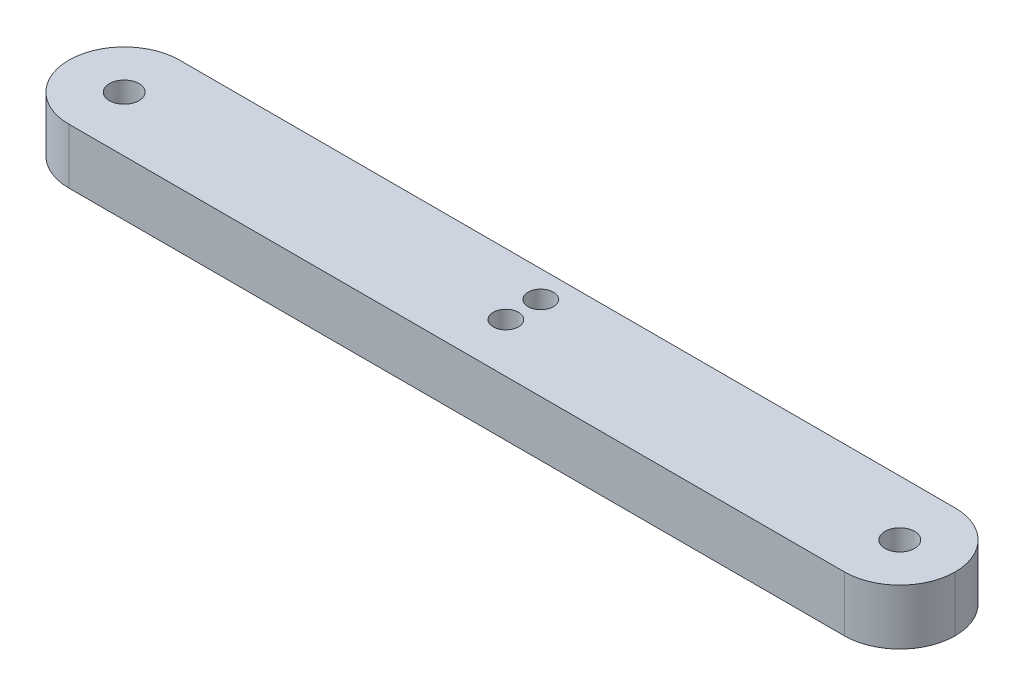
from build123d import *

# Parameters (mm, degrees)
SKETCH1_R               = 1.7
BOSS_EXTRUDE1_DEPTH     = 6.35
FILLET1_R               = 6.35
CUT_EXTRUDE1_DEPTH      = 52.587643869
CUT_EXTRUDE1_DEPTH_BACK = 52.587643869
SKETCH3_R               = 1.45


with BuildPart() as part:
    # Sketch1 → Boss-Extrude1 (new body)
    with BuildSketch(Plane(origin=(0, 0, 0), x_dir=(1, 0, 0), z_dir=(0, 1, 0))):
        Polygon((-50.8, 6.35), (-50.8, -6.35), (-6.35, -6.35), (6.35, -6.35), (50.8, -6.35), (50.8, 6.35), (6.35, 6.35), (-6.35, 6.35), align=None)
        with Locations(Location((-44.45, 0, 0), (0, 0, 270))):
            Circle(SKETCH1_R, mode=Mode.SUBTRACT)
        with Locations(Location((44.45, 0, 0), (0, 0, 270))):
            Circle(SKETCH1_R, mode=Mode.SUBTRACT)
    extrude(amount=BOSS_EXTRUDE1_DEPTH)

    # Fillet1
    fillet1_edges = [part.edges().sort_by_distance(p)[0] for p in [
        (50.8, 3.175, -6.35),
        (-50.8, 3.175, -6.35),
        (-50.8, 3.175, 6.35),
        (50.8, 3.175, 6.35),
    ]]
    fillet(fillet1_edges, radius=FILLET1_R - 0.0001)  # a hair under: the kernel refuses the full size

    # Sketch3 → Cut-Extrude1 (cut, two sides: drawn at the far end of the back side and taken through both)
    with BuildSketch(Plane(origin=(0, 6.35, 0), x_dir=(1, 0, 0), z_dir=(0, 1, 0)).offset(-CUT_EXTRUDE1_DEPTH_BACK)):
        with Locations(Location((0, -0.704506674, 0), (0, 0, 270))):
            Circle(SKETCH3_R)
        with Locations(Location((0, 3.295493326, 0), (0, 0, 270))):
            Circle(SKETCH3_R)
    extrude(amount=CUT_EXTRUDE1_DEPTH + CUT_EXTRUDE1_DEPTH_BACK, mode=Mode.SUBTRACT)


solid = part.part
